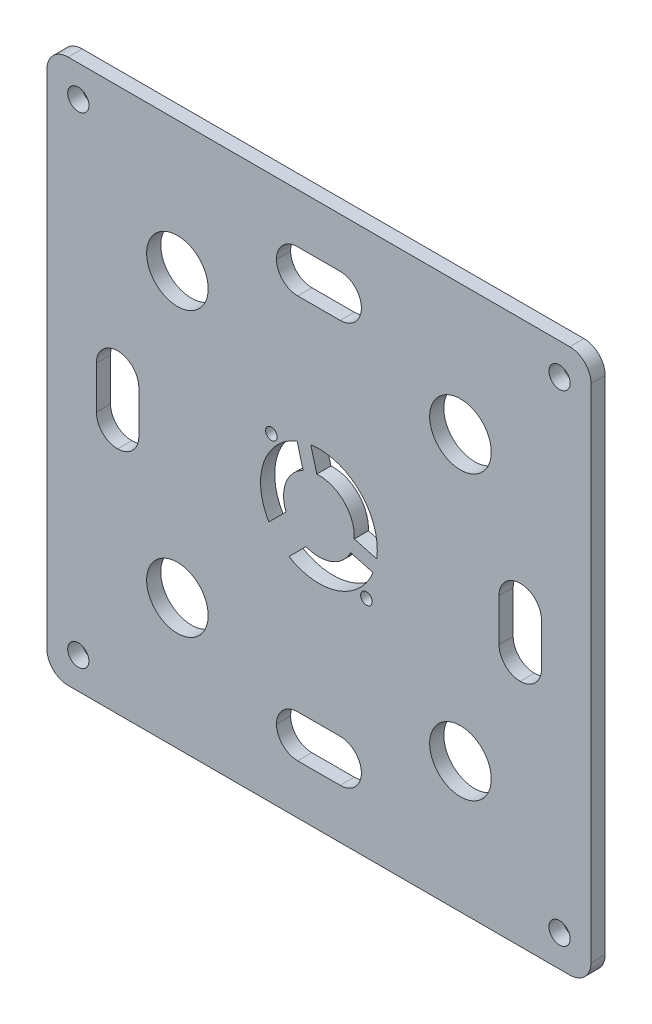
from build123d import *

# Parameters (mm, degrees)
SKETCH_1_R          = 1.5
SKETCH_1_R_2        = 4.35
EXTRUDE_1_DEPTH     = 2
SKETCH_3_R          = 0.82
CUT_EXTRUDE_2_DEPTH = 10
EXTRUDE_START       = -2
EXTRUDE_2_DEPTH     = 2
FILLET_1_R          = 3


with BuildPart() as part:
    # 草圖1 → 填料-伸長1 (new body)
    with BuildSketch(Plane.XY):
        with BuildLine():
            Line((-35.45, 38.45), (35.45, 38.45))
            ThreePointArc((35.45, 38.45), (37.571320344, 37.571320344), (38.45, 35.45))
            Line((38.45, 35.45), (38.45, -35.45))
            ThreePointArc((38.45, -35.45), (37.571320344, -37.571320344), (35.45, -38.45))
            Line((35.45, -38.45), (-35.45, -38.45))
            ThreePointArc((-35.45, -38.45), (-37.571320344, -37.571320344), (-38.45, -35.45))
            Line((-38.45, -35.45), (-38.45, 35.45))
            ThreePointArc((-38.45, 35.45), (-37.571320344, 37.571320344), (-35.45, 38.45))
        make_face()
        with Locations((-34, 34)):
            Circle(SKETCH_1_R, mode=Mode.SUBTRACT)
        with Locations((34, 34)):
            Circle(SKETCH_1_R, mode=Mode.SUBTRACT)
        with Locations((34, -34)):
            Circle(SKETCH_1_R, mode=Mode.SUBTRACT)
        with Locations((-34, -34)):
            Circle(SKETCH_1_R, mode=Mode.SUBTRACT)
        with Locations((-20, 20)):
            Circle(SKETCH_1_R_2, mode=Mode.SUBTRACT)
        with Locations((20, 20)):
            Circle(SKETCH_1_R_2, mode=Mode.SUBTRACT)
        with Locations((-20, -20)):
            Circle(SKETCH_1_R_2, mode=Mode.SUBTRACT)
        with Locations((20, -20)):
            Circle(SKETCH_1_R_2, mode=Mode.SUBTRACT)
        with BuildLine():
            Line((-18.5, 31.45), (18.5, 31.45))
            Line((18.5, 31.45), (18.5, 26.837397166))
            ThreePointArc((18.5, 26.837397166), (15.050252532, 24.949747468), (13.162602834, 21.5))
            Line((13.162602834, 21.5), (-13.162602834, 21.5))
            ThreePointArc((-13.162602834, 21.5), (-15.050252532, 24.949747468), (-18.5, 26.837397166))
            Line((-18.5, 26.837397166), (-18.5, 31.45))
        make_face(mode=Mode.SUBTRACT)
        with BuildLine():
            Line((-31.45, 18.5), (-31.45, -18.5))
            Line((-31.45, -18.5), (-26.837397166, -18.5))
            ThreePointArc((-26.837397166, -18.5), (-24.949747468, -15.050252532), (-21.5, -13.162602834))
            Line((-21.5, -13.162602834), (-21.5, 13.162602834))
            ThreePointArc((-21.5, 13.162602834), (-24.949747468, 15.050252532), (-26.837397166, 18.5))
            Line((-26.837397166, 18.5), (-31.45, 18.5))
        make_face(mode=Mode.SUBTRACT)
        with BuildLine():
            Line((26.837397166, 18.5), (31.45, 18.5))
            Line((31.45, 18.5), (31.45, -18.5))
            Line((31.45, -18.5), (26.837397166, -18.5))
            ThreePointArc((26.837397166, -18.5), (24.949747468, -15.050252532), (21.5, -13.162602834))
            Line((21.5, -13.162602834), (21.5, 13.162602834))
            ThreePointArc((21.5, 13.162602834), (24.949747468, 15.050252532), (26.837397166, 18.5))
        make_face(mode=Mode.SUBTRACT)
        with BuildLine():
            Line((-18.5, -31.45), (-18.5, -26.837397166))
            ThreePointArc((-18.5, -26.837397166), (-15.050252532, -24.949747468), (-13.162602834, -21.5))
            Line((-13.162602834, -21.5), (13.162602834, -21.5))
            ThreePointArc((13.162602834, -21.5), (15.050252532, -24.949747468), (18.5, -26.837397166))
            Line((18.5, -26.837397166), (18.5, -31.45))
            Line((18.5, -31.45), (-18.5, -31.45))
        make_face(mode=Mode.SUBTRACT)
    extrude(amount=EXTRUDE_1_DEPTH)

    # 草圖3 → 除料-伸長2 (cut)
    with BuildSketch(Plane.XY.offset(2)):
        with BuildLine():
            Line((-7.073829274, -4.245402149), (-4.654583912, -1.826156787))
            ThreePointArc((-4.654583912, -1.826156787), (-4.667257292, 1.793518711), (-2.233875019, 4.473231762))
            Line((-2.233875019, 4.473231762), (-3.085438902, 7.651311442))
            ThreePointArc((-3.085438902, 7.651311442), (-7.822124458, 2.622378494), (-7.073829274, -4.245402149))
        make_face()
        with BuildLine():
            Line((-1.15358725, 8.168949532), (-0.302023366, 4.990869853))
            ThreePointArc((-0.302023366, 4.990869853), (3.427089375, 3.640749705), (5, 0))
            ThreePointArc((5, 0), (4.997716942, -0.151080668), (4.990869853, -0.302023366))
            Line((4.990869853, -0.302023366), (8.168949532, -1.15358725))
            ThreePointArc((8.168949532, -1.15358725), (8.229712438, -0.578215514), (8.25, 0))
            ThreePointArc((8.25, 0), (5.410425362, 6.228145583), (-1.15358725, 8.168949532))
        make_face()
        with BuildLine():
            ThreePointArc((4.473231762, -2.233875019), (1.793518711, -4.667257292), (-1.826156787, -4.654583912))
            Line((-1.826156787, -4.654583912), (-4.245402149, -7.073829274))
            ThreePointArc((-4.245402149, -7.073829274), (2.622378494, -7.822124458), (7.651311442, -3.085438902))
            Line((7.651311442, -3.085438902), (4.473231762, -2.233875019))
        make_face()
        with Locations((6.717514421, -6.717514421)):
            Circle(SKETCH_3_R)
        with Locations((-6.717514421, 6.717514421)):
            Circle(SKETCH_3_R)
    extrude(amount=-CUT_EXTRUDE_2_DEPTH, mode=Mode.SUBTRACT)

    # 草圖4 → 填料-伸長2 (add)
    with BuildSketch(Plane.XY.offset(2).offset(EXTRUDE_START)):
        with BuildLine():
            Line((-31.45, -6), (-31.45, -18.5))
            Line((-31.45, -18.5), (-26.837397166, -18.5))
            ThreePointArc((-26.837397166, -18.5), (-24.949747468, -15.050252532), (-21.5, -13.162602834))
            Line((-21.5, -13.162602834), (-21.5, 13.162602834))
            ThreePointArc((-21.5, 13.162602834), (-24.949747468, 15.050252532), (-26.837397166, 18.5))
            Line((-26.837397166, 18.5), (-31.45, 18.5))
            Line((-31.45, 18.5), (-31.45, 6))
            Line((-31.45, 6), (-25.45, 6))
            Line((-25.45, 6), (-25.45, -6))
            Line((-25.45, -6), (-31.45, -6))
        make_face()
        with BuildLine():
            Line((-6, 31.45), (-18.5, 31.45))
            Line((-18.5, 31.45), (-18.5, 26.837397166))
            ThreePointArc((-18.5, 26.837397166), (-15.050252532, 24.949747468), (-13.162602834, 21.5))
            Line((-13.162602834, 21.5), (13.162602834, 21.5))
            ThreePointArc((13.162602834, 21.5), (15.050252532, 24.949747468), (18.5, 26.837397166))
            Line((18.5, 26.837397166), (18.5, 31.45))
            Line((18.5, 31.45), (6, 31.45))
            Line((6, 31.45), (6, 25.45))
            Line((6, 25.45), (-6, 25.45))
            Line((-6, 25.45), (-6, 31.45))
        make_face()
        with BuildLine():
            Line((31.45, 6), (31.45, 18.5))
            Line((31.45, 18.5), (26.837397166, 18.5))
            ThreePointArc((26.837397166, 18.5), (24.949747468, 15.050252532), (21.5, 13.162602834))
            Line((21.5, 13.162602834), (21.5, -13.162602834))
            ThreePointArc((21.5, -13.162602834), (24.949747468, -15.050252532), (26.837397166, -18.5))
            Line((26.837397166, -18.5), (31.45, -18.5))
            Line((31.45, -18.5), (31.45, -6))
            Line((31.45, -6), (25.45, -6))
            Line((25.45, -6), (25.45, 6))
            Line((25.45, 6), (31.45, 6))
        make_face()
        with BuildLine():
            Line((6, -31.45), (18.5, -31.45))
            Line((18.5, -31.45), (18.5, -26.837397166))
            ThreePointArc((18.5, -26.837397166), (15.050252532, -24.949747468), (13.162602834, -21.5))
            Line((13.162602834, -21.5), (-13.162602834, -21.5))
            ThreePointArc((-13.162602834, -21.5), (-15.050252532, -24.949747468), (-18.5, -26.837397166))
            Line((-18.5, -26.837397166), (-18.5, -31.45))
            Line((-18.5, -31.45), (-6, -31.45))
            Line((-6, -31.45), (-6, -25.45))
            Line((-6, -25.45), (6, -25.45))
            Line((6, -25.45), (6, -31.45))
        make_face()
    extrude(amount=EXTRUDE_2_DEPTH)

    # 圓角1
    fillet_1_edges = [part.edges().sort_by_distance(p)[0] for p in [
        (-25.45, -6, 1),
        (-31.45, -6, 1),
        (-25.45, 6, 1),
        (-31.45, 6, 1),
        (6, 31.45, 1),
        (6, 25.45, 1),
        (-6, 31.45, 1),
        (-6, 25.45, 1),
        (31.45, 6, 1),
        (25.45, 6, 1),
        (31.45, -6, 1),
        (25.45, -6, 1),
        (-6, -31.45, 1),
        (-6, -25.45, 1),
        (6, -31.45, 1),
        (6, -25.45, 1),
    ]]
    fillet(fillet_1_edges, radius=FILLET_1_R - 0.0001)  # a hair under: the kernel refuses the full size


solid = part.part
